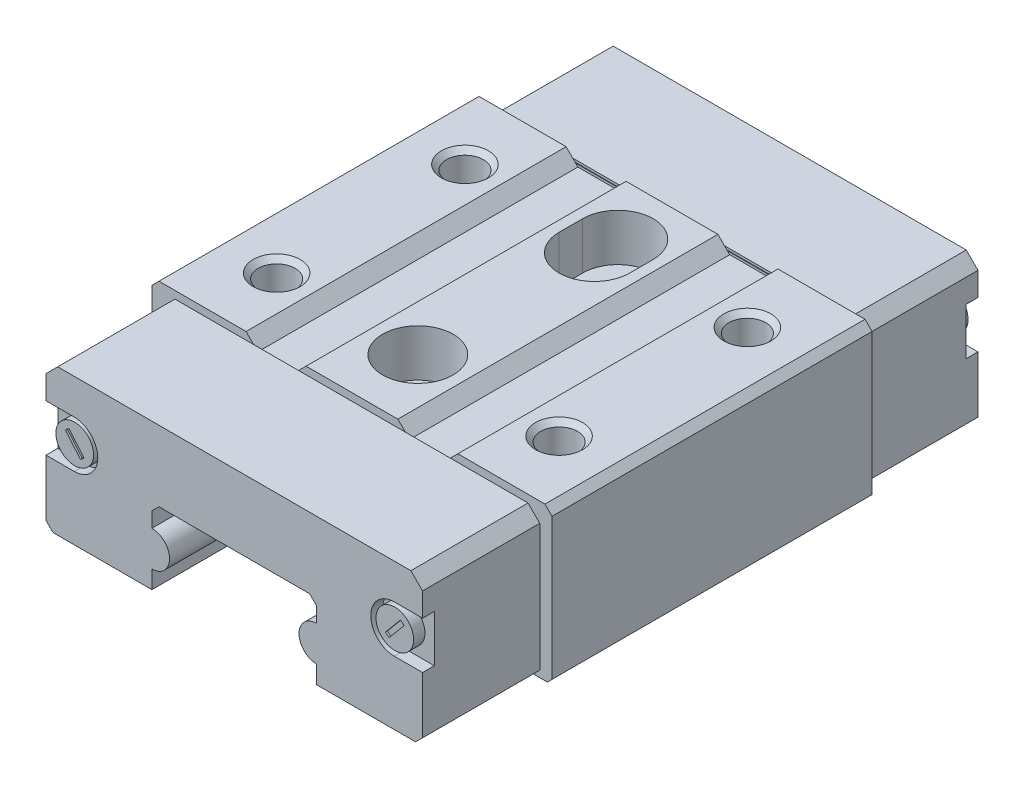
from build123d import *

# Parameters (mm, degrees)
BOSS_EXTRUDE1_DEPTH      = 6.8
BOSS_EXTRUDE1_DEPTH_BACK = 6.8
BOSS_EXTRUDE2_DEPTH      = 5
SKETCH3_W                = 80
SKETCH3_H                = 80
CUT_EXTRUDE1_DEPTH       = 0.02
BOSS_EXTRUDE3_START      = -5
BOSS_EXTRUDE3_DEPTH      = 5
CUT_EXTRUDE2_START       = -0.02
SKETCH5_W                = 80
SKETCH5_H                = 80
CUT_EXTRUDE2_DEPTH       = 0.02
CUT_EXTRUDE3_DEPTH       = 0.02
CUT_EXTRUDE4_START       = -0.5
SKETCH7_R                = 0.8
CUT_EXTRUDE4_DEPTH       = 0.5
CUT_EXTRUDE5_START       = -0.02
CUT_EXTRUDE5_DEPTH       = 0.02
SKETCH9_R                = 0.8
CUT_EXTRUDE6_DEPTH       = 0.5
SKETCH14_W               = 1.5
SKETCH14_H               = 2
CUT_EXTRUDE7_DEPTH       = 2
CUT_EXTRUDE8_DEPTH       = 0.1
CUT_EXTRUDE9_DEPTH       = 0.1
CUT_EXTRUDE10_DEPTH      = 0.1
CUT_EXTRUDE11_DEPTH      = 0.1


with BuildPart() as part:
    # Sketch1 → Boss-Extrude1 (new, two sides: drawn at the far end of the back side and taken through both)
    with BuildSketch(Plane.XY.offset(-BOSS_EXTRUDE1_DEPTH_BACK)):
        with BuildLine():
            Line((-8.5, 6.2), (-8.5, 0.197989899))
            Line((-8.5, 0.197989899), (-8.302010101, 0))
            Line((-8.302010101, 0), (-3.5, 0))
            Line((-3.5, 0), (-3.5, 0.76))
            ThreePointArc((-3.5, 0.76), (-2.75, 1.51), (-3.5, 2.26))
            Line((-3.5, 2.26), (-3.5, 2.903015152))
            Line((-3.5, 2.903015152), (-3.203015152, 3.2))
            Line((-3.203015152, 3.2), (3.203015152, 3.2))
            Line((3.203015152, 3.2), (3.5, 2.903015152))
            Line((3.5, 2.903015152), (3.5, 2.26))
            ThreePointArc((3.5, 2.26), (2.75, 1.51), (3.5, 0.76))
            Line((3.5, 0.76), (3.5, 0))
            Line((3.5, 0), (8.302010101, 0))
            Line((8.302010101, 0), (8.5, 0.197989899))
            Line((8.5, 0.197989899), (8.5, 6.2))
            Line((8.5, 6.2), (8.2, 6.5))
            Line((8.2, 6.5), (4.5, 6.5))
            Line((4.5, 6.5), (4, 6))
            Line((4, 6), (2.45, 6))
            Line((2.45, 6), (1.95, 6.5))
            Line((1.95, 6.5), (-1.95, 6.5))
            Line((-1.95, 6.5), (-2.45, 6))
            Line((-2.45, 6), (-4, 6))
            Line((-4, 6), (-4.5, 6.5))
            Line((-4.5, 6.5), (-8.2, 6.5))
            Line((-8.2, 6.5), (-8.5, 6.2))
        make_face()
    extrude(amount=BOSS_EXTRUDE1_DEPTH + BOSS_EXTRUDE1_DEPTH_BACK)

    # Sketch2 → Boss-Extrude2 (add)
    with BuildSketch(Plane.XY.offset(6.8)):
        with BuildLine():
            Line((-8, 5.701489719), (-8, 0.296984848))
            Line((-8, 0.296984848), (-7.703015152, 0))
            Line((-7.703015152, 0), (-3.5, 0))
            Line((-3.5, 0), (-3.5, 0.76))
            ThreePointArc((-3.5, 0.76), (-2.75, 1.51), (-3.5, 2.26))
            Line((-3.5, 2.26), (-3.5, 2.903015152))
            Line((-3.5, 2.903015152), (-3.203015152, 3.2))
            Line((-3.203015152, 3.2), (3.203015152, 3.2))
            Line((3.203015152, 3.2), (3.5, 2.903015152))
            Line((3.5, 2.903015152), (3.5, 2.26))
            ThreePointArc((3.5, 2.26), (2.75, 1.51), (3.5, 0.76))
            Line((3.5, 0.76), (3.5, 0))
            Line((3.5, 0), (7.703015152, 0))
            Line((7.703015152, 0), (8, 0.296984848))
            Line((8, 0.296984848), (8, 5.701489719))
            Line((8, 5.701489719), (7.501489719, 6.2))
            Line((7.501489719, 6.2), (-7.501489719, 6.2))
            Line((-7.501489719, 6.2), (-8, 5.701489719))
        make_face()
    extrude(amount=BOSS_EXTRUDE2_DEPTH)

    # Sketch3 → Cut-Extrude1 (cut)
    with BuildSketch(Plane.XY.offset(6.8)):
        Rectangle(SKETCH3_W, SKETCH3_H)
        with BuildLine():
            Line((-7.9, 5.601489719), (-7.9, 0.396984848))
            Line((-7.9, 0.396984848), (-7.603015152, 0.1))
            Line((-7.603015152, 0.1), (-3.6, 0.1))
            Line((-3.6, 0.1), (-3.6, 0.86))
            ThreePointArc((-3.6, 0.86), (-2.95, 1.51), (-3.6, 2.16))
            Line((-3.6, 2.16), (-3.6, 3.003015152))
            Line((-3.6, 3.003015152), (-3.303015152, 3.3))
            Line((-3.303015152, 3.3), (3.303015152, 3.3))
            Line((3.303015152, 3.3), (3.6, 3.003015152))
            Line((3.6, 3.003015152), (3.6, 2.16))
            ThreePointArc((3.6, 2.16), (2.95, 1.51), (3.6, 0.86))
            Line((3.6, 0.86), (3.6, 0.1))
            Line((3.6, 0.1), (7.603015152, 0.1))
            Line((7.603015152, 0.1), (7.9, 0.396984848))
            Line((7.9, 0.396984848), (7.9, 5.601489719))
            Line((7.9, 5.601489719), (7.401489719, 6.1))
            Line((7.401489719, 6.1), (-7.401489719, 6.1))
            Line((-7.401489719, 6.1), (-7.9, 5.601489719))
        make_face(mode=Mode.SUBTRACT)
    extrude(amount=CUT_EXTRUDE1_DEPTH, mode=Mode.SUBTRACT)

    # Sketch4 → Boss-Extrude3 (add)
    with BuildSketch(Plane.XY.offset(-6.8).offset(BOSS_EXTRUDE3_START)):
        with BuildLine():
            Line((-8, 5.701489719), (-8, 0.296984848))
            Line((-8, 0.296984848), (-7.703015152, 0))
            Line((-7.703015152, 0), (-3.5, 0))
            Line((-3.5, 0), (-3.5, 0.76))
            ThreePointArc((-3.5, 0.76), (-2.75, 1.51), (-3.5, 2.26))
            Line((-3.5, 2.26), (-3.5, 2.903015152))
            Line((-3.5, 2.903015152), (-3.203015152, 3.2))
            Line((-3.203015152, 3.2), (3.203015152, 3.2))
            Line((3.203015152, 3.2), (3.5, 2.903015152))
            Line((3.5, 2.903015152), (3.5, 2.26))
            ThreePointArc((3.5, 2.26), (2.75, 1.51), (3.5, 0.76))
            Line((3.5, 0.76), (3.5, 0))
            Line((3.5, 0), (7.703015152, 0))
            Line((7.703015152, 0), (8, 0.296984848))
            Line((8, 0.296984848), (8, 5.701489719))
            Line((8, 5.701489719), (7.501489719, 6.2))
            Line((7.501489719, 6.2), (-7.501489719, 6.2))
            Line((-7.501489719, 6.2), (-8, 5.701489719))
        make_face()
    extrude(amount=BOSS_EXTRUDE3_DEPTH)

    # Sketch5 → Cut-Extrude2 (cut)
    with BuildSketch(Plane.XY.offset(-6.8).offset(CUT_EXTRUDE2_START)):
        Rectangle(SKETCH5_W, SKETCH5_H)
        with BuildLine():
            Line((-7.9, 5.601489719), (-7.9, 0.396984848))
            Line((-7.9, 0.396984848), (-7.603015152, 0.1))
            Line((-7.603015152, 0.1), (-3.6, 0.1))
            Line((-3.6, 0.1), (-3.6, 0.86))
            ThreePointArc((-3.6, 0.86), (-2.95, 1.51), (-3.6, 2.16))
            Line((-3.6, 2.16), (-3.6, 3.003015152))
            Line((-3.6, 3.003015152), (-3.303015152, 3.3))
            Line((-3.303015152, 3.3), (3.303015152, 3.3))
            Line((3.303015152, 3.3), (3.6, 3.003015152))
            Line((3.6, 3.003015152), (3.6, 2.16))
            ThreePointArc((3.6, 2.16), (2.95, 1.51), (3.6, 0.86))
            Line((3.6, 0.86), (3.6, 0.1))
            Line((3.6, 0.1), (7.603015152, 0.1))
            Line((7.603015152, 0.1), (7.9, 0.396984848))
            Line((7.9, 0.396984848), (7.9, 5.601489719))
            Line((7.9, 5.601489719), (7.401489719, 6.1))
            Line((7.401489719, 6.1), (-7.401489719, 6.1))
            Line((-7.401489719, 6.1), (-7.9, 5.601489719))
        make_face(mode=Mode.SUBTRACT)
    extrude(amount=CUT_EXTRUDE2_DEPTH, mode=Mode.SUBTRACT)

    # Sketch6 → Cut-Extrude3 (cut)
    with BuildSketch(Plane.XY.offset(-11.8)):
        with BuildLine():
            Line((-13.6, 2.7), (-6.8, 2.7))
            ThreePointArc((-6.8, 2.7), (-5.8, 3.7), (-6.8, 4.7))
            Line((-6.8, 4.7), (-12.6, 4.7))
            Line((-12.6, 4.7), (-12.6, 7.7))
            Line((-12.6, 7.7), (12.6, 7.7))
            Line((12.6, 7.7), (12.6, 4.7))
            Line((12.6, 4.7), (6.8, 4.7))
            ThreePointArc((6.8, 4.7), (5.8, 3.7), (6.8, 2.7))
            Line((6.8, 2.7), (13.6, 2.7))
            Line((13.6, 2.7), (13.6, 9.7))
            Line((13.6, 9.7), (-13.6, 9.7))
            Line((-13.6, 9.7), (-13.6, 2.7))
        make_face()
    extrude(amount=CUT_EXTRUDE3_DEPTH, mode=Mode.SUBTRACT)

    # Sketch7 → Cut-Extrude4 (cut)
    with BuildSketch(Plane.XY.offset(11.8).offset(CUT_EXTRUDE4_START)):
        with BuildLine():
            Line((-13.6, 2.7), (-6.8, 2.7))
            ThreePointArc((-6.8, 2.7), (-5.8, 3.7), (-6.8, 4.7))
            Line((-6.8, 4.7), (-12.6, 4.7))
            Line((-12.6, 4.7), (-12.6, 7.7))
            Line((-12.6, 7.7), (12.6, 7.7))
            Line((12.6, 7.7), (12.6, 4.7))
            Line((12.6, 4.7), (6.8, 4.7))
            ThreePointArc((6.8, 4.7), (5.8, 3.7), (6.8, 2.7))
            Line((6.8, 2.7), (13.6, 2.7))
            Line((13.6, 2.7), (13.6, 9.7))
            Line((13.6, 9.7), (-13.6, 9.7))
            Line((-13.6, 9.7), (-13.6, 2.7))
        make_face()
        with Locations((6.8, 3.7)):
            Circle(SKETCH7_R, mode=Mode.SUBTRACT)
        with Locations((-6.8, 3.7)):
            Circle(SKETCH7_R, mode=Mode.SUBTRACT)
    extrude(amount=CUT_EXTRUDE4_DEPTH, mode=Mode.SUBTRACT)

    # Sketch8 → Cut-Extrude5 (cut)
    with BuildSketch(Plane.XY.offset(11.8).offset(CUT_EXTRUDE5_START)):
        with BuildLine():
            Line((-13.6, 2.7), (-6.8, 2.7))
            ThreePointArc((-6.8, 2.7), (-5.8, 3.7), (-6.8, 4.7))
            Line((-6.8, 4.7), (-12.6, 4.7))
            Line((-12.6, 4.7), (-12.6, 7.7))
            Line((-12.6, 7.7), (12.6, 7.7))
            Line((12.6, 7.7), (12.6, 4.7))
            Line((12.6, 4.7), (6.8, 4.7))
            ThreePointArc((6.8, 4.7), (5.8, 3.7), (6.8, 2.7))
            Line((6.8, 2.7), (13.6, 2.7))
            Line((13.6, 2.7), (13.6, 9.7))
            Line((13.6, 9.7), (-13.6, 9.7))
            Line((-13.6, 9.7), (-13.6, 2.7))
        make_face()
    extrude(amount=CUT_EXTRUDE5_DEPTH, mode=Mode.SUBTRACT)

    # Sketch9 → Cut-Extrude6 (cut)
    with BuildSketch(Plane.XY.offset(-11.8)):
        with BuildLine():
            Line((-13.6, 2.7), (-6.8, 2.7))
            ThreePointArc((-6.8, 2.7), (-5.8, 3.7), (-6.8, 4.7))
            Line((-6.8, 4.7), (-12.6, 4.7))
            Line((-12.6, 4.7), (-12.6, 7.7))
            Line((-12.6, 7.7), (12.6, 7.7))
            Line((12.6, 7.7), (12.6, 4.7))
            Line((12.6, 4.7), (6.8, 4.7))
            ThreePointArc((6.8, 4.7), (5.8, 3.7), (6.8, 2.7))
            Line((6.8, 2.7), (13.6, 2.7))
            Line((13.6, 2.7), (13.6, 9.7))
            Line((13.6, 9.7), (-13.6, 9.7))
            Line((-13.6, 9.7), (-13.6, 2.7))
        make_face()
        with Locations((6.8, 3.7)):
            Circle(SKETCH9_R, mode=Mode.SUBTRACT)
        with Locations((-6.8, 3.7)):
            Circle(SKETCH9_R, mode=Mode.SUBTRACT)
    extrude(amount=CUT_EXTRUDE6_DEPTH, mode=Mode.SUBTRACT)

    # Sketch10 → Cut-Revolve1 (revolve, cut)
    with BuildSketch(Plane(origin=(6, 0, 0), x_dir=(0, 0, -1), z_dir=(1, 0, 0))):
        Polygon((-4, 6.5), (-3, 6.5), (-3.2165, 6.2835), (-3.2165, 3.25), (-4, 2.797646064), align=None)
    revolve(axis=Axis((6, 2.797646064, 4), (0, 1, 0)), mode=Mode.SUBTRACT)

    # Sketch11 → Cut-Revolve2 (revolve, cut)
    with BuildSketch(Plane(origin=(-6, 0, 0), x_dir=(0, 0, -1), z_dir=(1, 0, 0))):
        Polygon((4, 6.5), (5, 6.5), (4.7835, 6.2835), (4.7835, 3.25), (4, 2.797646064), align=None)
    revolve(axis=Axis((-6, 2.797646064, -4), (0, 1, 0)), mode=Mode.SUBTRACT)

    # Sketch12 → Cut-Revolve3 (revolve, cut)
    with BuildSketch(Plane(origin=(6, 0, 0), x_dir=(0, 0, -1), z_dir=(1, 0, 0))):
        Polygon((4, 6.5), (5, 6.5), (4.7835, 6.2835), (4.7835, 3.25), (4, 2.797646064), align=None)
    revolve(axis=Axis((6, 2.797646064, -4), (0, 1, 0)), mode=Mode.SUBTRACT)

    # Sketch13 → Cut-Revolve4 (revolve, cut)
    with BuildSketch(Plane(origin=(-6, 0, 0), x_dir=(0, 0, -1), z_dir=(1, 0, 0))):
        Polygon((-4, 6.5), (-3, 6.5), (-3.2165, 6.2835), (-3.2165, 3.25), (-4, 2.797646064), align=None)
    revolve(axis=Axis((-6, 2.797646064, 4), (0, 1, 0)), mode=Mode.SUBTRACT)

    # Sketch14 → Cut-Revolve5 (revolve, cut)
    with BuildSketch(Plane(origin=(0, 0, 0), x_dir=(0, 0, -1), z_dir=(1, 0, 0))):
        with Locations((-4.75, 5.5)):
            Rectangle(SKETCH14_W, SKETCH14_H)
    revolve(axis=Axis((0, 6.5, 4), (0, -1, 0)), mode=Mode.SUBTRACT)

    # Sketch15 → Cut-Extrude7 (cut)
    with BuildSketch(Plane(origin=(0, 6.5, 0), x_dir=(-1, 0, 0), z_dir=(0, 1, 0))):
        with BuildLine():
            Line((1.5, -4.5), (1.5, -3.5))
            ThreePointArc((1.5, -3.5), (1.060660172, -2.439339828), (0, -2))
            ThreePointArc((0, -2), (-1.060660172, -2.439339828), (-1.5, -3.5))
            Line((-1.5, -3.5), (-1.5, -4.5))
            ThreePointArc((-1.5, -4.5), (-1.060660172, -5.560660172), (0, -6))
            ThreePointArc((0, -6), (1.060660172, -5.560660172), (1.5, -4.5))
        make_face()
    extrude(amount=-CUT_EXTRUDE7_DEPTH, mode=Mode.SUBTRACT)

    # Sketch16 → Cut-Extrude8 (cut)
    with BuildSketch(Plane.XY.offset(11.8)):
        Polygon((6.402001751, 3.381256539), (6.555210639, 3.252699017), (7.197998249, 4.018743461), (7.044789361, 4.147300983), align=None)
    extrude(amount=-CUT_EXTRUDE8_DEPTH, mode=Mode.SUBTRACT)

    # Sketch17 → Cut-Extrude9 (cut)
    with BuildSketch(Plane.XY.offset(11.8)):
        Polygon((-7.197998249, 4.018743461), (-6.555210639, 3.252699017), (-6.402001751, 3.381256539), (-7.044789361, 4.147300983), align=None)
    extrude(amount=-CUT_EXTRUDE9_DEPTH, mode=Mode.SUBTRACT)

    # Sketch18 → Cut-Extrude10 (cut)
    with BuildSketch(Plane.XY.offset(-11.8)):
        Polygon((6.402001751, 3.381256539), (6.555210639, 3.252699017), (7.197998249, 4.018743461), (7.044789361, 4.147300983), align=None)
    extrude(amount=CUT_EXTRUDE10_DEPTH, mode=Mode.SUBTRACT)

    # Sketch19 → Cut-Extrude11 (cut)
    with BuildSketch(Plane.XY.offset(-11.8)):
        Polygon((-7.197998249, 4.018743461), (-6.555210639, 3.252699017), (-6.402001751, 3.381256539), (-7.044789361, 4.147300983), align=None)
    extrude(amount=CUT_EXTRUDE11_DEPTH, mode=Mode.SUBTRACT)


solid = part.part
